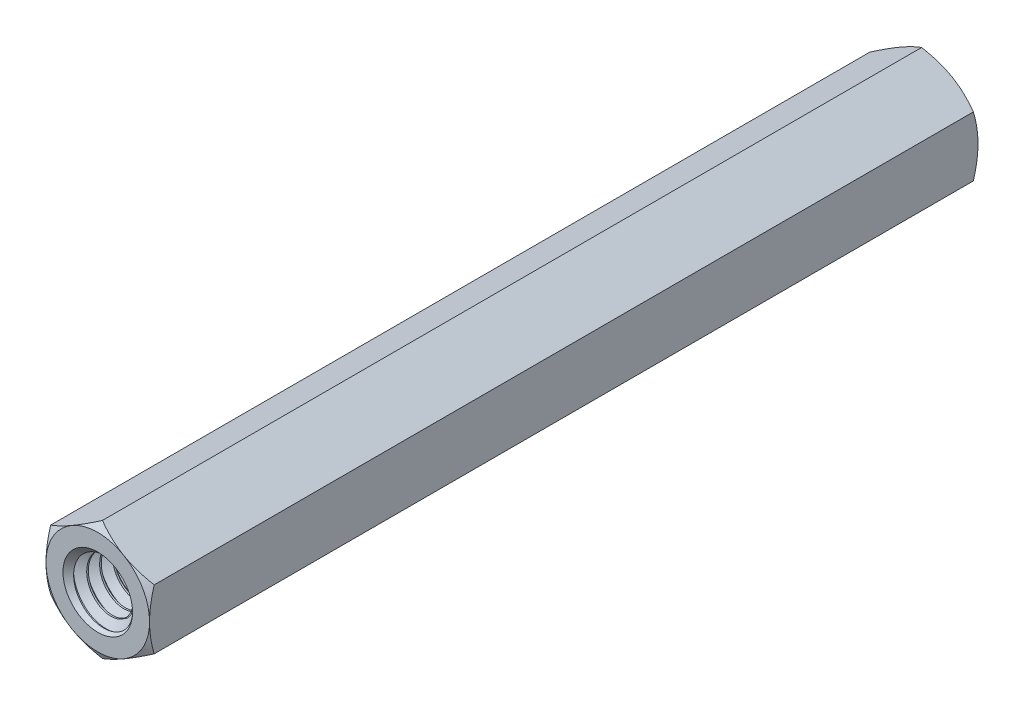
from build123d import *

# Parameters (mm, degrees)
EXTRUDE1_DEPTH          = 25.4
EXTRUDE1_DEPTH_BACK     = 25.4
SKETCH1_R               = 2.0828
SWEEP1_PITCH            = 0.79375
EXTRUDE2_DEPTH          = 52.821542378
SKETCH8_OUTSIDE_W       = 201.828
SKETCH8_OUTSIDE_H       = 202.81
SKETCH8_OUTSIDE_R       = 3.175
EXTRUDE4_DEPTH          = 52.821542378
EXTRUDE4_DRAFT          = -60
MIRROR1_COPY_1_SKETCH_W = 201.828
MIRROR1_COPY_1_SKETCH_H = 202.81
MIRROR1_COPY_1_SKETCH_R = 3.175
MIRROR1_COPY_1_DEPTH    = 52.821542378
MIRROR1_COPY_1_DRAFT    = -60
SKETCH9_W               = 31.75
SKETCH9_H               = 2.1336


with BuildPart() as part:
    # Sketch1 → Extrude1 (new, two sides: drawn at the far end of the back side and taken through both)
    with BuildSketch(Plane.XY.offset(-EXTRUDE1_DEPTH_BACK)):
        Polygon((0, 3.666174209), (-3.175, 1.833087105), (-3.175, -1.833087105), (0, -3.666174209), (3.175, -1.833087105), (3.175, 1.833087105), align=None)
        Circle(SKETCH1_R, mode=Mode.SUBTRACT)
    extrude(amount=EXTRUDE1_DEPTH + EXTRUDE1_DEPTH_BACK)

    # Sweep1: arcs per turn and ends read off the stored shape
    # Sweep1: the profile of Sketch12 profile screwed along a right-hand helix through 65 turns, 6 arcs to a turn; built about Z, then put on its axis
    sweep1_z = Axis((0, 0, 0), (0, 0, 1))
    sweep1_corners = [(2.0834, 0, -0.69487766), (2.0834, 0, 0.00034641), (1.567244252, 0, -0.29765625), (1.567244252, 0, -0.396875)]
    with BuildLine(mode=Mode.PRIVATE) as sweep1_profile:
        Line(sweep1_corners[0], sweep1_corners[1])
        Line(sweep1_corners[1], sweep1_corners[2])
        Line(sweep1_corners[2], sweep1_corners[3])
        Line(sweep1_corners[3], sweep1_corners[0])
    sweep1_cap = Face(sweep1_profile.wire())
    sweep1_turn_angles = [0, 30, 60, 90, 120, 150, 180, 210, 240, 270, 300, 330, 360]
    sweep1_turn_weights = [1, 0.8660254037844387, 1, 0.8660254037844387, 1, 0.8660254037844387, 1, 0.8660254037844387, 1, 0.8660254037844387, 1, 0.8660254037844387, 1]
    sweep1_turn_rails = [Edge.make_bspline([Vector(p[0], p[1], 0).rotate(sweep1_z, sweep1_turn_angles[k]) / sweep1_turn_weights[k] + Vector(0, 0, p[2] + SWEEP1_PITCH * sweep1_turn_angles[k] / 360) for k in range(13)], [0, 0, 0, 1, 1, 2, 2, 3, 3, 4, 4, 5, 5, 6, 6, 6], 2, sweep1_turn_weights) for p in sweep1_corners]
    sweep1_turn_sides = [Face.make_surface_from_curves(sweep1_turn_rails[p[0]], sweep1_turn_rails[p[1]]) for p in [(0, 1), (1, 2), (2, 3), (3, 0)]]
    sweep1 = Plane(origin=(0, 0, -25.4), x_dir=(0, 1, 0), z_dir=(0, 0, 1)) * Solid(Shell([*[p.moved(Location((0, 0, SWEEP1_PITCH * i))) for i in range(65) for p in sweep1_turn_sides], sweep1_cap, sweep1_cap.rotate(sweep1_z, 23400).moved(Location((0, 0, SWEEP1_PITCH * 23400 / 360)))]))
    add(sweep1)

    # Sketch6 → Extrude2 (cut, through all)
    with BuildSketch(Plane(origin=(0, 0, -25.4), x_dir=(-1, 0, 0), z_dir=(0, 0, -1))):
        Polygon((0, 3.666174209), (-3.175, 1.833087105), (-3.175, -1.833087105), (0, -3.666174209), (3.175, -1.833087105), (3.175, 1.833087105), align=None)
    extrude2 = extrude(amount=EXTRUDE2_DEPTH, mode=Mode.SUBTRACT)

    # Extrude3 cone 1 section (through the dimple's axis) → Extrude3 (revolve, cut)
    with BuildSketch(Plane(origin=(0, 0, -25.4), x_dir=(0, 1, 0), z_dir=(1, 0, 0))):
        Polygon((0, 0), (2.1336, 0), (0, 2.28800588), align=None)
    extrude3 = revolve(axis=Axis((0, 0, -25.4), (0, 0, 1)), mode=Mode.SUBTRACT)


with BuildPart() as extrude4_tool:
    # Sketch8 outside → Extrude4 (with draft: the straight prism first)
    with BuildSketch(Plane(origin=(0, 0, -25.4), x_dir=(-1, 0, 0), z_dir=(0, 0, -1))):
        Rectangle(SKETCH8_OUTSIDE_W, SKETCH8_OUTSIDE_H)
        Circle(SKETCH8_OUTSIDE_R, mode=Mode.SUBTRACT)
    extrude(amount=-EXTRUDE4_DEPTH)
    # Extrude4: the draft: its side faces are tilted about the plane it starts from
    extrude4_sides = [extrude4_tool.faces().sort_by_distance(p)[0] for p in [
        (0, -101.405, 1.010771189),
        (-100.914, 0, 1.010771189),
        (0, 101.405, 1.010771189),
        (100.914, 0, 1.010771189),
        (3.175, 0, 1.010771189),
    ]]
    draft(extrude4_sides, Plane(origin=(0, 0, -25.4), x_dir=(-1, 0, 0), z_dir=(0, 0, -1)), EXTRUDE4_DRAFT)


with BuildPart() as part_1:
    add(part.part)

    # Extrude4: cut by extrude4_tool
    add(extrude4_tool.part, mode=Mode.SUBTRACT)

    # Mirror1: Extrude2, Extrude3 across plane
    add(extrude2.mirror(Plane.XY), mode=Mode.SUBTRACT)
    add(extrude3.mirror(Plane.XY), mode=Mode.SUBTRACT)


with BuildPart() as mirror1_copy_1_tool:
    # Mirror1 copy 1 sketch → Mirror1 copy 1 (with draft: the straight prism first)
    with BuildSketch(Plane(origin=(0, 0, 25.4), x_dir=(-1, 0, 0), z_dir=(0, 0, 1))):
        Rectangle(MIRROR1_COPY_1_SKETCH_W, MIRROR1_COPY_1_SKETCH_H)
        Circle(MIRROR1_COPY_1_SKETCH_R, mode=Mode.SUBTRACT)
    extrude(amount=-MIRROR1_COPY_1_DEPTH)
    # Mirror1 copy 1: the draft: its side faces are tilted about the plane it starts from
    mirror1_copy_1_sides = [mirror1_copy_1_tool.faces().sort_by_distance(p)[0] for p in [
        (0, -101.405, -1.010771189),
        (-100.914, 0, -1.010771189),
        (0, 101.405, -1.010771189),
        (100.914, 0, -1.010771189),
        (3.175, 0, -1.010771189),
    ]]
    draft(mirror1_copy_1_sides, Plane(origin=(0, 0, 25.4), x_dir=(-1, 0, 0), z_dir=(0, 0, 1)), MIRROR1_COPY_1_DRAFT)


with BuildPart() as part_2:
    add(part_1.part)

    # Mirror1 copy 1: cut by mirror1_copy_1_tool
    add(mirror1_copy_1_tool.part, mode=Mode.SUBTRACT)

    # Sketch9 → Revolve 2 (revolve)
    with BuildSketch(Plane(origin=(0, 0, 0), x_dir=(0, 0, -1), z_dir=(1, 0, 0)), mode=Mode.PRIVATE) as revolve_2_sk:
        with Locations((0, 1.0668)):
            Rectangle(SKETCH9_W, SKETCH9_H)
    revolve(revolve_2_sk.sketch.rotate(Axis((0, 0, 25.4), (0, 0, -1)), 270), axis=Axis((0, 0, 25.4), (0, 0, -1)))


solid = part_2.part
